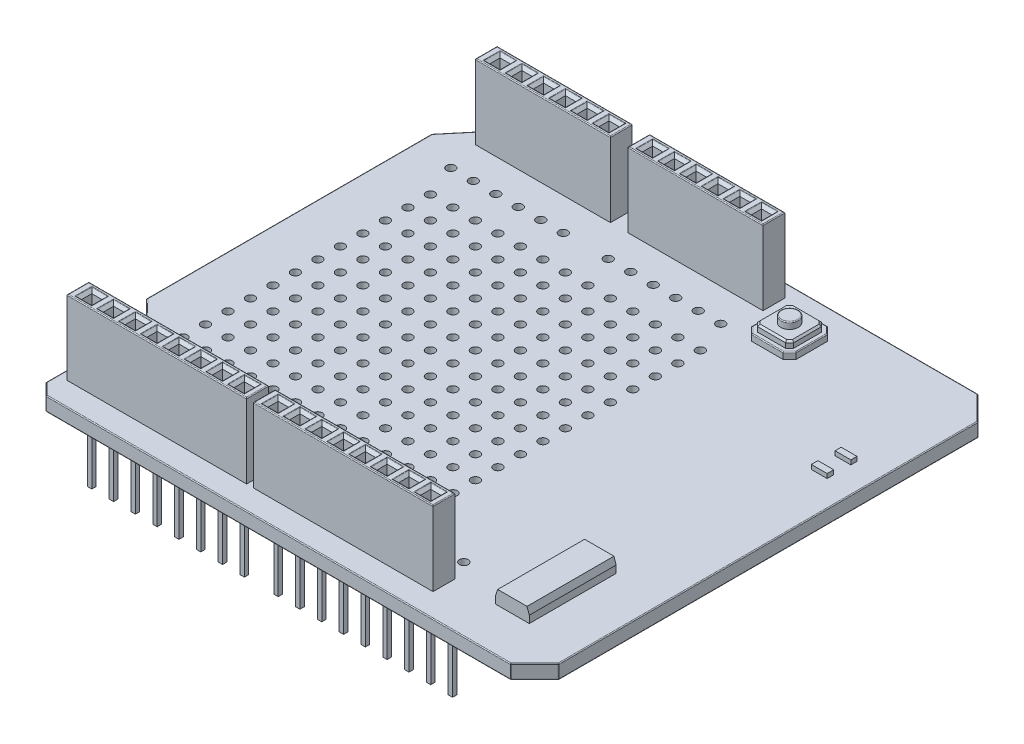
from build123d import *
from OCP.BRepFilletAPI import BRepFilletAPI_MakeChamfer

# Parameters (mm, degrees)
SKETCH1_W           = 59.91
SKETCH1_H           = 53.6
BOSS_EXTRUDE1_DEPTH = 1.63
SKETCH2_W           = 15.5
SKETCH2_H           = 2.5
SKETCH2_W_2         = 20.6
BOSS_EXTRUDE2_DEPTH = 8.54
BOSS_EXTRUDE3_DEPTH = 0.75
BOSS_EXTRUDE4_DEPTH = 0.75
SKETCH5_R           = 1
BOSS_EXTRUDE5_DEPTH = 0.75
CHAMFER1_SIZE       = 0.2
FILLET1_R           = 0.1
FILLET2_R           = 0.1
SKETCH6_W           = 3.88
SKETCH6_H           = 9.97
BOSS_EXTRUDE6_DEPTH = 1.58
CHAMFER2_SIZE       = 0.75
CHAMFER2_SIZE2      = 0.25824571
SKETCH7_W           = 1.18
SKETCH7_H           = 1.18
CUT_EXTRUDE1_DEPTH  = 6.58
CHAMFER3_SIZE       = 0.35
CHAMFER4_SIZE       = 2.75
CUT_EXTRUDE2_DEPTH  = 42.09104069
CHAMFER5_SIZE       = 1.32
SKETCH9_R           = 0.5
CUT_EXTRUDE3_DEPTH  = 42.09104069
SKETCH10_W          = 1.812646184
SKETCH10_H          = 0.701669491
SKETCH10_H_2        = 0.755269243
BOSS_EXTRUDE7_DEPTH = 0.5
SKETCH11_W          = 0.5
SKETCH11_H          = 0.5
BOSS_EXTRUDE8_DEPTH = 8.75
FILLET5_R           = 0.1
FILLET6_R           = 0.1


with BuildPart() as part:
    # Sketch1 → Boss-Extrude1 (new body)
    with BuildSketch(Plane(origin=(0, 0, 0), x_dir=(1, 0, 0), z_dir=(0, 1, 0))):
        Rectangle(SKETCH1_W, SKETCH1_H)
    extrude(amount=BOSS_EXTRUDE1_DEPTH)

    # Sketch2 → Boss-Extrude2 (add)
    with BuildSketch(Plane(origin=(0, 1.63, 0), x_dir=(1, 0, 0), z_dir=(0, 1, 0))):
        with Locations((-18.635, 23.98)):
            Rectangle(SKETCH2_W, SKETCH2_H)
        with Locations((-1.135, 23.98)):
            Rectangle(SKETCH2_W, SKETCH2_H)
        with Locations((5.295, -22.848402701)):
            Rectangle(SKETCH2_W_2, SKETCH2_H)
        with Locations((-16.085, -22.848402701)):
            Rectangle(SKETCH2_W_2, SKETCH2_H)
    extrude(amount=BOSS_EXTRUDE2_DEPTH)

    # Sketch3 → Boss-Extrude3 (add)
    with BuildSketch(Plane(origin=(0, 1.63, 0), x_dir=(1, 0, 0), z_dir=(0, 1, 0))):
        Polygon((8.995, 24.15), (12.605, 24.15), (13.355, 23.4), (13.355, 19.79), (12.605, 19.04), (8.995, 19.04), (8.245, 19.79), (8.245, 23.4), align=None)
    extrude(amount=BOSS_EXTRUDE3_DEPTH)

    # Sketch4 → Boss-Extrude4 (add)
    with BuildSketch(Plane(origin=(0, 2.38, 0), x_dir=(1, 0, 0), z_dir=(0, 1, 0))):
        Polygon((8.745, 19.997106781), (9.202106781, 19.54), (12.397893219, 19.54), (12.855, 19.997106781), (12.855, 23.192893219), (12.397893219, 23.65), (9.202106781, 23.65), (8.745, 23.192893219), align=None)
    extrude(amount=BOSS_EXTRUDE4_DEPTH)

    # Sketch5 → Boss-Extrude5 (add)
    with BuildSketch(Plane(origin=(0, 3.13, 0), x_dir=(1, 0, 0), z_dir=(0, 1, 0))):
        with Locations((10.8, 21.595)):
            Circle(SKETCH5_R)
    extrude(amount=BOSS_EXTRUDE5_DEPTH)

    # Chamfer1
    chamfer1_edges = [part.edges().sort_by_distance(p)[0] for p in [
        (8.973553391, 3.13, -23.421446609),
        (10.8, 3.13, -23.65),
        (12.626446609, 3.13, -23.421446609),
        (8.745, 3.13, -21.595),
        (8.973553391, 3.13, -19.768553391),
        (10.8, 3.13, -19.54),
        (12.626446609, 3.13, -19.768553391),
        (12.855, 3.13, -21.595),
    ]]
    chamfer(chamfer1_edges, length=CHAMFER1_SIZE)

    # Fillet1
    fillet1_edges = [part.edges().sort_by_distance(p)[0] for p in [
        (9.8, 3.88, -21.595),
    ]]
    fillet(fillet1_edges, radius=FILLET1_R)

    # Fillet2
    fillet2_edges = [part.edges().sort_by_distance(p)[0] for p in [
        (8.62, 2.38, -19.415),
        (8.245, 2.38, -21.595),
        (8.62, 2.38, -23.775),
        (10.8, 2.38, -24.15),
        (12.98, 2.38, -23.775),
        (10.8, 2.38, -19.04),
        (12.98, 2.38, -19.415),
        (13.355, 2.38, -21.595),
    ]]
    fillet(fillet2_edges, radius=FILLET2_R)

    # Sketch6 → Boss-Extrude6 (add)
    with BuildSketch(Plane(origin=(0, 1.63, 0), x_dir=(1, 0, 0), z_dir=(0, 1, 0))):
        with Locations((22.345, -16.765)):
            Rectangle(SKETCH6_W, SKETCH6_H)
    extrude(amount=BOSS_EXTRUDE6_DEPTH)

    # Chamfer2: one chamfer whose edges measure the first distance from different faces: ONE call of the kernel's chamfer builder (chamfer() names one face for all edges)
    chamfer2_edges_1 = [part.edges().sort_by_distance(p)[0] for p in [
        (20.405, 3.21, 16.765),
    ]]
    chamfer2_side_1 = [part.faces().sort_by_distance(p)[0] for p in [
        (20.405, 2.42, 16.765),
    ]]
    chamfer2_edges_2 = [part.edges().sort_by_distance(p)[0] for p in [
        (24.285, 3.21, 16.765),
    ]]
    chamfer2_side_2 = [part.faces().sort_by_distance(p)[0] for p in [
        (24.285, 2.42, 16.765),
    ]]
    chamfer2 = BRepFilletAPI_MakeChamfer(part.part.solid().wrapped)
    for e in chamfer2_edges_1:
        chamfer2.Add(CHAMFER2_SIZE, CHAMFER2_SIZE2, e.wrapped, chamfer2_side_1[0].wrapped)  # the first distance lies on this face
    for e in chamfer2_edges_2:
        chamfer2.Add(CHAMFER2_SIZE, CHAMFER2_SIZE2, e.wrapped, chamfer2_side_2[0].wrapped)  # the first distance lies on this face
    add(Compound.cast(chamfer2.Shape()), mode=Mode.REPLACE)

    # Sketch7 → Cut-Extrude1 (cut)
    with BuildSketch(Plane(origin=(0, 10.17, 0), x_dir=(1, 0, 0), z_dir=(0, 1, 0))):
        with Locations((-24.795, 23.98)):
            Rectangle(SKETCH7_W, SKETCH7_H)
        with Locations((-22.295, 23.98)):
            Rectangle(SKETCH7_W, SKETCH7_H)
        with Locations((-19.795, 23.98)):
            Rectangle(SKETCH7_W, SKETCH7_H)
        with Locations((-17.295, 23.98)):
            Rectangle(SKETCH7_W, SKETCH7_H)
        with Locations((-14.795, 23.98)):
            Rectangle(SKETCH7_W, SKETCH7_H)
        with Locations((-12.295, 23.98)):
            Rectangle(SKETCH7_W, SKETCH7_H)
        with Locations((-24.795, -22.848402701)):
            Rectangle(SKETCH7_W, SKETCH7_H)
        with Locations((-7.295, 23.98)):
            Rectangle(SKETCH7_W, SKETCH7_H)
        with Locations((-4.795, 23.98)):
            Rectangle(SKETCH7_W, SKETCH7_H)
        with Locations((-2.295, 23.98)):
            Rectangle(SKETCH7_W, SKETCH7_H)
        with Locations((0.205, 23.98)):
            Rectangle(SKETCH7_W, SKETCH7_H)
        with Locations((2.705, 23.98)):
            Rectangle(SKETCH7_W, SKETCH7_H)
        with Locations((5.205, 23.98)):
            Rectangle(SKETCH7_W, SKETCH7_H)
        with Locations((-22.295, -22.848402701)):
            Rectangle(SKETCH7_W, SKETCH7_H)
        with Locations((-19.795, -22.848402701)):
            Rectangle(SKETCH7_W, SKETCH7_H)
        with Locations((-17.295, -22.848402701)):
            Rectangle(SKETCH7_W, SKETCH7_H)
        with Locations((-14.795, -22.848402701)):
            Rectangle(SKETCH7_W, SKETCH7_H)
        with Locations((-12.295, -22.848402701)):
            Rectangle(SKETCH7_W, SKETCH7_H)
        with Locations((-9.795, -22.848402701)):
            Rectangle(SKETCH7_W, SKETCH7_H)
        with Locations((-7.295, -22.848402701)):
            Rectangle(SKETCH7_W, SKETCH7_H)
        with Locations((-3.415, -22.848402701)):
            Rectangle(SKETCH7_W, SKETCH7_H)
        with Locations((-0.915, -22.848402701)):
            Rectangle(SKETCH7_W, SKETCH7_H)
        with Locations((1.585, -22.848402701)):
            Rectangle(SKETCH7_W, SKETCH7_H)
        with Locations((4.085, -22.848402701)):
            Rectangle(SKETCH7_W, SKETCH7_H)
        with Locations((6.585, -22.848402701)):
            Rectangle(SKETCH7_W, SKETCH7_H)
        with Locations((9.085, -22.848402701)):
            Rectangle(SKETCH7_W, SKETCH7_H)
        with Locations((11.585, -22.848402701)):
            Rectangle(SKETCH7_W, SKETCH7_H)
        with Locations((14.085, -22.848402701)):
            Rectangle(SKETCH7_W, SKETCH7_H)
    extrude(amount=-CUT_EXTRUDE1_DEPTH, mode=Mode.SUBTRACT)

    # Chamfer3
    chamfer3_edges = [part.edges().sort_by_distance(p)[0] for p in [
        (-24.795, 10.17, -23.39),
        (-24.205, 10.17, -23.98),
        (-25.385, 10.17, -23.98),
        (-24.795, 10.17, -24.57),
        (14.085, 10.17, 23.438402701),
        (14.675, 10.17, 22.848402701),
        (13.495, 10.17, 22.848402701),
        (14.085, 10.17, 22.258402701),
        (11.585, 10.17, 23.438402701),
        (12.175, 10.17, 22.848402701),
        (10.995, 10.17, 22.848402701),
        (11.585, 10.17, 22.258402701),
        (9.085, 10.17, 23.438402701),
        (9.675, 10.17, 22.848402701),
        (8.495, 10.17, 22.848402701),
        (9.085, 10.17, 22.258402701),
        (6.585, 10.17, 23.438402701),
        (7.175, 10.17, 22.848402701),
        (5.995, 10.17, 22.848402701),
        (6.585, 10.17, 22.258402701),
        (4.085, 10.17, 23.438402701),
        (4.675, 10.17, 22.848402701),
        (3.495, 10.17, 22.848402701),
        (4.085, 10.17, 22.258402701),
        (1.585, 10.17, 23.438402701),
        (2.175, 10.17, 22.848402701),
        (0.995, 10.17, 22.848402701),
        (1.585, 10.17, 22.258402701),
        (-0.915, 10.17, 23.438402701),
        (-0.325, 10.17, 22.848402701),
        (-1.505, 10.17, 22.848402701),
        (-0.915, 10.17, 22.258402701),
        (-3.415, 10.17, 23.438402701),
        (-2.825, 10.17, 22.848402701),
        (-4.005, 10.17, 22.848402701),
        (-3.415, 10.17, 22.258402701),
        (-7.295, 10.17, 23.438402701),
        (-7.885, 10.17, 22.848402701),
        (-6.705, 10.17, 22.848402701),
        (-7.295, 10.17, 22.258402701),
        (-9.795, 10.17, 23.438402701),
        (-10.385, 10.17, 22.848402701),
        (-9.205, 10.17, 22.848402701),
        (-9.795, 10.17, 22.258402701),
        (-12.295, 10.17, 23.438402701),
        (-12.885, 10.17, 22.848402701),
        (-11.705, 10.17, 22.848402701),
        (-12.295, 10.17, 22.258402701),
        (-14.795, 10.17, 23.438402701),
        (-15.385, 10.17, 22.848402701),
        (-14.205, 10.17, 22.848402701),
        (-14.795, 10.17, 22.258402701),
        (-17.295, 10.17, 23.438402701),
        (-17.885, 10.17, 22.848402701),
        (-16.705, 10.17, 22.848402701),
        (-17.295, 10.17, 22.258402701),
        (-19.795, 10.17, 23.438402701),
        (-20.385, 10.17, 22.848402701),
        (-19.205, 10.17, 22.848402701),
        (-19.795, 10.17, 22.258402701),
        (-22.295, 10.17, 23.438402701),
        (-22.885, 10.17, 22.848402701),
        (-21.705, 10.17, 22.848402701),
        (-22.295, 10.17, 22.258402701),
        (-24.795, 10.17, 23.438402701),
        (-25.385, 10.17, 22.848402701),
        (-24.205, 10.17, 22.848402701),
        (-24.795, 10.17, 22.258402701),
        (5.205, 10.17, -24.57),
        (4.615, 10.17, -23.98),
        (5.795, 10.17, -23.98),
        (5.205, 10.17, -23.39),
        (2.705, 10.17, -24.57),
        (2.115, 10.17, -23.98),
        (3.295, 10.17, -23.98),
        (2.705, 10.17, -23.39),
        (0.205, 10.17, -24.57),
        (-0.385, 10.17, -23.98),
        (0.795, 10.17, -23.98),
        (0.205, 10.17, -23.39),
        (-2.295, 10.17, -24.57),
        (-2.885, 10.17, -23.98),
        (-1.705, 10.17, -23.98),
        (-2.295, 10.17, -23.39),
        (-4.795, 10.17, -24.57),
        (-5.385, 10.17, -23.98),
        (-4.205, 10.17, -23.98),
        (-4.795, 10.17, -23.39),
        (-7.295, 10.17, -24.57),
        (-7.885, 10.17, -23.98),
        (-6.705, 10.17, -23.98),
        (-7.295, 10.17, -23.39),
        (-12.295, 10.17, -23.39),
        (-12.885, 10.17, -23.98),
        (-12.295, 10.17, -24.57),
        (-11.705, 10.17, -23.98),
        (-15.385, 10.17, -23.98),
        (-14.795, 10.17, -24.57),
        (-14.205, 10.17, -23.98),
        (-14.795, 10.17, -23.39),
        (-17.885, 10.17, -23.98),
        (-17.295, 10.17, -24.57),
        (-16.705, 10.17, -23.98),
        (-17.295, 10.17, -23.39),
        (-20.385, 10.17, -23.98),
        (-19.795, 10.17, -24.57),
        (-19.205, 10.17, -23.98),
        (-19.795, 10.17, -23.39),
        (-22.295, 10.17, -23.39),
        (-21.705, 10.17, -23.98),
        (-22.885, 10.17, -23.98),
        (-22.295, 10.17, -24.57),
    ]]
    chamfer(chamfer3_edges, length=CHAMFER3_SIZE)

    # Chamfer4
    chamfer4_edges = [part.edges().sort_by_distance(p)[0] for p in [
        (29.955, 0.815, 26.8),
        (29.955, 0.815, -26.8),
    ]]
    chamfer(chamfer4_edges, length=CHAMFER4_SIZE)

    # Sketch8 → Cut-Extrude2 (cut, through all)
    with BuildSketch(Plane(origin=(0, 1.63, 0), x_dir=(1, 0, 0), z_dir=(0, 1, 0))):
        Polygon((-27.415, 26.8), (-27.415, 24.34), (-29.955, 21.3), (-29.955, 26.8), align=None)
        Polygon((-27.415, -14), (-27.415, -26.8), (-29.955, -26.8), (-29.955, -11.4), align=None)
    extrude(amount=-CUT_EXTRUDE2_DEPTH, mode=Mode.SUBTRACT)

    # Chamfer5
    chamfer5_edges = [part.edges().sort_by_distance(p)[0] for p in [
        (-27.415, 0.815, 26.8),
    ]]
    chamfer(chamfer5_edges, length=CHAMFER5_SIZE)

    # Sketch9 → Cut-Extrude3 (cut, through all)
    with BuildSketch(Plane(origin=(0, 1.63, 0), x_dir=(1, 0, 0), z_dir=(0, 1, 0))):
        with Locations((6.955, 15.2)):
            Circle(SKETCH9_R)
        with Locations((4.375, 15.2)):
            Circle(SKETCH9_R)
        with Locations((1.795, 15.2)):
            Circle(SKETCH9_R)
        with Locations((-0.785, 15.2)):
            Circle(SKETCH9_R)
        with Locations((-3.365, 15.2)):
            Circle(SKETCH9_R)
        with Locations((-5.945, 15.2)):
            Circle(SKETCH9_R)
        with Locations((-8.525, 15.2)):
            Circle(SKETCH9_R)
        with Locations((-11.105, 15.2)):
            Circle(SKETCH9_R)
        with Locations((-13.685, 15.2)):
            Circle(SKETCH9_R)
        with Locations((-16.265, 15.2)):
            Circle(SKETCH9_R)
        with Locations((-18.845, 15.2)):
            Circle(SKETCH9_R)
        with Locations((-21.425, 15.2)):
            Circle(SKETCH9_R)
        with Locations((-24.005, 15.2)):
            Circle(SKETCH9_R)
        with Locations((6.955, 12.62)):
            Circle(SKETCH9_R)
        with Locations((4.375, 12.62)):
            Circle(SKETCH9_R)
        with Locations((1.795, 12.62)):
            Circle(SKETCH9_R)
        with Locations((-0.785, 12.62)):
            Circle(SKETCH9_R)
        with Locations((-3.365, 12.62)):
            Circle(SKETCH9_R)
        with Locations((-5.945, 12.62)):
            Circle(SKETCH9_R)
        with Locations((-8.525, 12.62)):
            Circle(SKETCH9_R)
        with Locations((-11.105, 12.62)):
            Circle(SKETCH9_R)
        with Locations((-13.685, 12.62)):
            Circle(SKETCH9_R)
        with Locations((-16.265, 12.62)):
            Circle(SKETCH9_R)
        with Locations((-18.845, 12.62)):
            Circle(SKETCH9_R)
        with Locations((-21.425, 12.62)):
            Circle(SKETCH9_R)
        with Locations((-24.005, 12.62)):
            Circle(SKETCH9_R)
        with Locations((6.955, 10.04)):
            Circle(SKETCH9_R)
        with Locations((4.375, 10.04)):
            Circle(SKETCH9_R)
        with Locations((1.795, 10.04)):
            Circle(SKETCH9_R)
        with Locations((-0.785, 10.04)):
            Circle(SKETCH9_R)
        with Locations((-3.365, 10.04)):
            Circle(SKETCH9_R)
        with Locations((-5.945, 10.04)):
            Circle(SKETCH9_R)
        with Locations((-8.525, 10.04)):
            Circle(SKETCH9_R)
        with Locations((-11.105, 10.04)):
            Circle(SKETCH9_R)
        with Locations((-13.685, 10.04)):
            Circle(SKETCH9_R)
        with Locations((-16.265, 10.04)):
            Circle(SKETCH9_R)
        with Locations((-18.845, 10.04)):
            Circle(SKETCH9_R)
        with Locations((-21.425, 10.04)):
            Circle(SKETCH9_R)
        with Locations((-24.005, 10.04)):
            Circle(SKETCH9_R)
        with Locations((6.955, 7.46)):
            Circle(SKETCH9_R)
        with Locations((4.375, 7.46)):
            Circle(SKETCH9_R)
        with Locations((1.795, 7.46)):
            Circle(SKETCH9_R)
        with Locations((-0.785, 7.46)):
            Circle(SKETCH9_R)
        with Locations((-3.365, 7.46)):
            Circle(SKETCH9_R)
        with Locations((-5.945, 7.46)):
            Circle(SKETCH9_R)
        with Locations((-8.525, 7.46)):
            Circle(SKETCH9_R)
        with Locations((-11.105, 7.46)):
            Circle(SKETCH9_R)
        with Locations((-13.685, 7.46)):
            Circle(SKETCH9_R)
        with Locations((-16.265, 7.46)):
            Circle(SKETCH9_R)
        with Locations((-18.845, 7.46)):
            Circle(SKETCH9_R)
        with Locations((-21.425, 7.46)):
            Circle(SKETCH9_R)
        with Locations((-24.005, 7.46)):
            Circle(SKETCH9_R)
        with Locations((6.955, 4.88)):
            Circle(SKETCH9_R)
        with Locations((4.375, 4.88)):
            Circle(SKETCH9_R)
        with Locations((1.795, 4.88)):
            Circle(SKETCH9_R)
        with Locations((-0.785, 4.88)):
            Circle(SKETCH9_R)
        with Locations((-3.365, 4.88)):
            Circle(SKETCH9_R)
        with Locations((-5.945, 4.88)):
            Circle(SKETCH9_R)
        with Locations((-8.525, 4.88)):
            Circle(SKETCH9_R)
        with Locations((-11.105, 4.88)):
            Circle(SKETCH9_R)
        with Locations((-13.685, 4.88)):
            Circle(SKETCH9_R)
        with Locations((-16.265, 4.88)):
            Circle(SKETCH9_R)
        with Locations((-18.845, 4.88)):
            Circle(SKETCH9_R)
        with Locations((-21.425, 4.88)):
            Circle(SKETCH9_R)
        with Locations((-24.005, 4.88)):
            Circle(SKETCH9_R)
        with Locations((6.955, 2.3)):
            Circle(SKETCH9_R)
        with Locations((4.375, 2.3)):
            Circle(SKETCH9_R)
        with Locations((1.795, 2.3)):
            Circle(SKETCH9_R)
        with Locations((-0.785, 2.3)):
            Circle(SKETCH9_R)
        with Locations((-3.365, 2.3)):
            Circle(SKETCH9_R)
        with Locations((-5.945, 2.3)):
            Circle(SKETCH9_R)
        with Locations((-8.525, 2.3)):
            Circle(SKETCH9_R)
        with Locations((-11.105, 2.3)):
            Circle(SKETCH9_R)
        with Locations((-13.685, 2.3)):
            Circle(SKETCH9_R)
        with Locations((-16.265, 2.3)):
            Circle(SKETCH9_R)
        with Locations((-18.845, 2.3)):
            Circle(SKETCH9_R)
        with Locations((-21.425, 2.3)):
            Circle(SKETCH9_R)
        with Locations((-24.005, 2.3)):
            Circle(SKETCH9_R)
        with Locations((6.955, -0.28)):
            Circle(SKETCH9_R)
        with Locations((4.375, -0.28)):
            Circle(SKETCH9_R)
        with Locations((1.795, -0.28)):
            Circle(SKETCH9_R)
        with Locations((-0.785, -0.28)):
            Circle(SKETCH9_R)
        with Locations((-3.365, -0.28)):
            Circle(SKETCH9_R)
        with Locations((-5.945, -0.28)):
            Circle(SKETCH9_R)
        with Locations((-8.525, -0.28)):
            Circle(SKETCH9_R)
        with Locations((-11.105, -0.28)):
            Circle(SKETCH9_R)
        with Locations((-13.685, -0.28)):
            Circle(SKETCH9_R)
        with Locations((-16.265, -0.28)):
            Circle(SKETCH9_R)
        with Locations((-18.845, -0.28)):
            Circle(SKETCH9_R)
        with Locations((-21.425, -0.28)):
            Circle(SKETCH9_R)
        with Locations((-24.005, -0.28)):
            Circle(SKETCH9_R)
        with Locations((6.955, -2.86)):
            Circle(SKETCH9_R)
        with Locations((4.375, -2.86)):
            Circle(SKETCH9_R)
        with Locations((1.795, -2.86)):
            Circle(SKETCH9_R)
        with Locations((-0.785, -2.86)):
            Circle(SKETCH9_R)
        with Locations((-3.365, -2.86)):
            Circle(SKETCH9_R)
        with Locations((-5.945, -2.86)):
            Circle(SKETCH9_R)
        with Locations((-8.525, -2.86)):
            Circle(SKETCH9_R)
        with Locations((-11.105, -2.86)):
            Circle(SKETCH9_R)
        with Locations((-13.685, -2.86)):
            Circle(SKETCH9_R)
        with Locations((-16.265, -2.86)):
            Circle(SKETCH9_R)
        with Locations((-18.845, -2.86)):
            Circle(SKETCH9_R)
        with Locations((-21.425, -2.86)):
            Circle(SKETCH9_R)
        with Locations((-24.005, -2.86)):
            Circle(SKETCH9_R)
        with Locations((6.955, -5.44)):
            Circle(SKETCH9_R)
        with Locations((4.375, -5.44)):
            Circle(SKETCH9_R)
        with Locations((1.795, -5.44)):
            Circle(SKETCH9_R)
        with Locations((-0.785, -5.44)):
            Circle(SKETCH9_R)
        with Locations((-3.365, -5.44)):
            Circle(SKETCH9_R)
        with Locations((-5.945, -5.44)):
            Circle(SKETCH9_R)
        with Locations((-8.525, -5.44)):
            Circle(SKETCH9_R)
        with Locations((-11.105, -5.44)):
            Circle(SKETCH9_R)
        with Locations((-13.685, -5.44)):
            Circle(SKETCH9_R)
        with Locations((-16.265, -5.44)):
            Circle(SKETCH9_R)
        with Locations((-18.845, -5.44)):
            Circle(SKETCH9_R)
        with Locations((-21.425, -5.44)):
            Circle(SKETCH9_R)
        with Locations((-24.005, -5.44)):
            Circle(SKETCH9_R)
        with Locations((6.955, -8.02)):
            Circle(SKETCH9_R)
        with Locations((4.375, -8.02)):
            Circle(SKETCH9_R)
        with Locations((1.795, -8.02)):
            Circle(SKETCH9_R)
        with Locations((-0.785, -8.02)):
            Circle(SKETCH9_R)
        with Locations((-3.365, -8.02)):
            Circle(SKETCH9_R)
        with Locations((-5.945, -8.02)):
            Circle(SKETCH9_R)
        with Locations((-8.525, -8.02)):
            Circle(SKETCH9_R)
        with Locations((-11.105, -8.02)):
            Circle(SKETCH9_R)
        with Locations((-13.685, -8.02)):
            Circle(SKETCH9_R)
        with Locations((-16.265, -8.02)):
            Circle(SKETCH9_R)
        with Locations((-18.845, -8.02)):
            Circle(SKETCH9_R)
        with Locations((-21.425, -8.02)):
            Circle(SKETCH9_R)
        with Locations((-24.005, -8.02)):
            Circle(SKETCH9_R)
        with Locations((6.955, -10.6)):
            Circle(SKETCH9_R)
        with Locations((4.375, -10.6)):
            Circle(SKETCH9_R)
        with Locations((1.795, -10.6)):
            Circle(SKETCH9_R)
        with Locations((-0.785, -10.6)):
            Circle(SKETCH9_R)
        with Locations((-3.365, -10.6)):
            Circle(SKETCH9_R)
        with Locations((-5.945, -10.6)):
            Circle(SKETCH9_R)
        with Locations((-8.525, -10.6)):
            Circle(SKETCH9_R)
        with Locations((-11.105, -10.6)):
            Circle(SKETCH9_R)
        with Locations((-13.685, -10.6)):
            Circle(SKETCH9_R)
        with Locations((-16.265, -10.6)):
            Circle(SKETCH9_R)
        with Locations((-18.845, -10.6)):
            Circle(SKETCH9_R)
        with Locations((-21.425, -10.6)):
            Circle(SKETCH9_R)
        with Locations((-24.005, -10.6)):
            Circle(SKETCH9_R)
        with Locations((6.955, -13.18)):
            Circle(SKETCH9_R)
        with Locations((4.375, -13.18)):
            Circle(SKETCH9_R)
        with Locations((1.795, -13.18)):
            Circle(SKETCH9_R)
        with Locations((-0.785, -13.18)):
            Circle(SKETCH9_R)
        with Locations((-3.365, -13.18)):
            Circle(SKETCH9_R)
        with Locations((-5.945, -13.18)):
            Circle(SKETCH9_R)
        with Locations((-8.525, -13.18)):
            Circle(SKETCH9_R)
        with Locations((-11.105, -13.18)):
            Circle(SKETCH9_R)
        with Locations((-13.685, -13.18)):
            Circle(SKETCH9_R)
        with Locations((-16.265, -13.18)):
            Circle(SKETCH9_R)
        with Locations((-18.845, -13.18)):
            Circle(SKETCH9_R)
        with Locations((-21.425, -13.18)):
            Circle(SKETCH9_R)
        with Locations((-24.005, -13.18)):
            Circle(SKETCH9_R)
        with Locations((6.955, -15.76)):
            Circle(SKETCH9_R)
        with Locations((4.375, -15.76)):
            Circle(SKETCH9_R)
        with Locations((1.795, -15.76)):
            Circle(SKETCH9_R)
        with Locations((-0.785, -15.76)):
            Circle(SKETCH9_R)
        with Locations((-3.365, -15.76)):
            Circle(SKETCH9_R)
        with Locations((-5.945, -15.76)):
            Circle(SKETCH9_R)
        with Locations((-8.525, -15.76)):
            Circle(SKETCH9_R)
        with Locations((-11.105, -15.76)):
            Circle(SKETCH9_R)
        with Locations((-13.685, -15.76)):
            Circle(SKETCH9_R)
        with Locations((-16.265, -15.76)):
            Circle(SKETCH9_R)
        with Locations((-18.845, -15.76)):
            Circle(SKETCH9_R)
        with Locations((-21.425, -15.76)):
            Circle(SKETCH9_R)
        with Locations((-24.005, -15.76)):
            Circle(SKETCH9_R)
        with Locations((-25.469940781, 19.005930056)):
            Circle(SKETCH9_R)
        with Locations((-22.889940781, 19.005930056)):
            Circle(SKETCH9_R)
        with Locations((-20.309940781, 19.005930056)):
            Circle(SKETCH9_R)
        with Locations((-17.729940781, 19.005930056)):
            Circle(SKETCH9_R)
        with Locations((-15.149940781, 19.005930056)):
            Circle(SKETCH9_R)
        with Locations((-12.569940781, 19.005930056)):
            Circle(SKETCH9_R)
        with Locations((-7.413471247, 19.005930056)):
            Circle(SKETCH9_R)
        with Locations((-4.833471247, 19.005930056)):
            Circle(SKETCH9_R)
        with Locations((-2.253471247, 19.005930056)):
            Circle(SKETCH9_R)
        with Locations((0.326528753, 19.005930056)):
            Circle(SKETCH9_R)
        with Locations((2.906528753, 19.005930056)):
            Circle(SKETCH9_R)
        with Locations((5.486528753, 19.005930056)):
            Circle(SKETCH9_R)
        with Locations((-25.469940781, -19.403210889)):
            Circle(SKETCH9_R)
        with Locations((-22.889940781, -19.403210889)):
            Circle(SKETCH9_R)
        with Locations((-20.309940781, -19.403210889)):
            Circle(SKETCH9_R)
        with Locations((-17.729940781, -19.403210889)):
            Circle(SKETCH9_R)
        with Locations((-15.149940781, -19.403210889)):
            Circle(SKETCH9_R)
        with Locations((-12.569940781, -19.403210889)):
            Circle(SKETCH9_R)
        with Locations((-9.989940781, -19.403210889)):
            Circle(SKETCH9_R)
        with Locations((-7.409940781, -19.403210889)):
            Circle(SKETCH9_R)
        with Locations((-3.631327581, -19.403210889)):
            Circle(SKETCH9_R)
        with Locations((-1.051327581, -19.403210889)):
            Circle(SKETCH9_R)
        with Locations((1.528672419, -19.403210889)):
            Circle(SKETCH9_R)
        with Locations((4.108672419, -19.403210889)):
            Circle(SKETCH9_R)
        with Locations((6.688672419, -19.403210889)):
            Circle(SKETCH9_R)
        with Locations((9.268672419, -19.403210889)):
            Circle(SKETCH9_R)
        with Locations((11.848672419, -19.403210889)):
            Circle(SKETCH9_R)
        with Locations((14.428672419, -19.403210889)):
            Circle(SKETCH9_R)
    extrude(amount=-CUT_EXTRUDE3_DEPTH, mode=Mode.SUBTRACT)

    # Sketch10 → Boss-Extrude7 (add)
    with BuildSketch(Plane(origin=(0, 1.63, 0), x_dir=(1, 0, 0), z_dir=(0, 1, 0))):
        with Locations((26.060630769, 12.805100933)):
            Rectangle(SKETCH10_W, SKETCH10_H)
        with Locations((26.060630769, 10.112931533)):
            Rectangle(SKETCH10_W, SKETCH10_H_2)
    extrude(amount=BOSS_EXTRUDE7_DEPTH)

    # Sketch11 → Boss-Extrude8 (add)
    with BuildSketch(Plane.XZ):
        with Locations((-22.295, 22.848402701)):
            Rectangle(SKETCH11_W, SKETCH11_H)
        with Locations((-24.795, 22.848402701)):
            Rectangle(SKETCH11_W, SKETCH11_H)
        with Locations((-19.795, 22.848402701)):
            Rectangle(SKETCH11_W, SKETCH11_H)
        with Locations((-17.295, 22.848402701)):
            Rectangle(SKETCH11_W, SKETCH11_H)
        with Locations((-14.795, 22.848402701)):
            Rectangle(SKETCH11_W, SKETCH11_H)
        with Locations((-12.295, 22.848402701)):
            Rectangle(SKETCH11_W, SKETCH11_H)
        with Locations((-9.795, 22.848402701)):
            Rectangle(SKETCH11_W, SKETCH11_H)
        with Locations((-7.295, 22.848402701)):
            Rectangle(SKETCH11_W, SKETCH11_H)
        with Locations((-0.915, 22.848402701)):
            Rectangle(SKETCH11_W, SKETCH11_H)
        with Locations((-3.415, 22.848402701)):
            Rectangle(SKETCH11_W, SKETCH11_H)
        with Locations((1.585, 22.848402701)):
            Rectangle(SKETCH11_W, SKETCH11_H)
        with Locations((4.085, 22.848402701)):
            Rectangle(SKETCH11_W, SKETCH11_H)
        with Locations((6.585, 22.848402701)):
            Rectangle(SKETCH11_W, SKETCH11_H)
        with Locations((9.085, 22.848402701)):
            Rectangle(SKETCH11_W, SKETCH11_H)
        with Locations((11.585, 22.848402701)):
            Rectangle(SKETCH11_W, SKETCH11_H)
        with Locations((14.085, 22.848402701)):
            Rectangle(SKETCH11_W, SKETCH11_H)
        with Locations((16.585, 22.848402701)):
            Rectangle(SKETCH11_W, SKETCH11_H)
        with Locations((-22.295, -23.98)):
            Rectangle(SKETCH11_W, SKETCH11_H)
        with Locations((-24.795, -23.98)):
            Rectangle(SKETCH11_W, SKETCH11_H)
        with Locations((-19.795, -23.98)):
            Rectangle(SKETCH11_W, SKETCH11_H)
        with Locations((-17.295, -23.98)):
            Rectangle(SKETCH11_W, SKETCH11_H)
        with Locations((-14.795, -23.98)):
            Rectangle(SKETCH11_W, SKETCH11_H)
        with Locations((-12.295, -23.98)):
            Rectangle(SKETCH11_W, SKETCH11_H)
        with Locations((-7.295, -23.98)):
            Rectangle(SKETCH11_W, SKETCH11_H)
        with Locations((-4.795, -23.98)):
            Rectangle(SKETCH11_W, SKETCH11_H)
        with Locations((-2.295, -23.98)):
            Rectangle(SKETCH11_W, SKETCH11_H)
        with Locations((0.205, -23.98)):
            Rectangle(SKETCH11_W, SKETCH11_H)
        with Locations((2.705, -23.98)):
            Rectangle(SKETCH11_W, SKETCH11_H)
        with Locations((5.205, -23.98)):
            Rectangle(SKETCH11_W, SKETCH11_H)
    extrude(amount=BOSS_EXTRUDE8_DEPTH)

    # Fillet5
    fillet5_edges = [part.edges().sort_by_distance(p)[0] for p in [
        (-8.885, 10.17, -23.98),
        (-1.135, 10.17, -25.23),
        (6.615, 10.17, -23.98),
        (-1.135, 10.17, -22.73),
        (-7.295, 10.17, -23.04),
        (-6.355, 10.17, -23.98),
        (-7.295, 10.17, -24.92),
        (-8.235, 10.17, -23.98),
        (-4.795, 10.17, -23.04),
        (-3.855, 10.17, -23.98),
        (-4.795, 10.17, -24.92),
        (-5.735, 10.17, -23.98),
        (-2.295, 10.17, -23.04),
        (-1.355, 10.17, -23.98),
        (-2.295, 10.17, -24.92),
        (-3.235, 10.17, -23.98),
        (0.205, 10.17, -23.04),
        (1.145, 10.17, -23.98),
        (0.205, 10.17, -24.92),
        (-0.735, 10.17, -23.98),
        (2.705, 10.17, -23.04),
        (3.645, 10.17, -23.98),
        (2.705, 10.17, -24.92),
        (1.765, 10.17, -23.98),
        (5.205, 10.17, -23.04),
        (6.145, 10.17, -23.98),
        (5.205, 10.17, -24.92),
        (4.265, 10.17, -23.98),
        (-18.635, 10.17, -22.73),
        (-26.385, 10.17, -23.98),
        (-18.635, 10.17, -25.23),
        (-10.885, 10.17, -23.98),
        (-24.795, 10.17, -24.92),
        (-25.735, 10.17, -23.98),
        (-24.795, 10.17, -23.04),
        (-23.855, 10.17, -23.98),
        (-22.295, 10.17, -24.92),
        (-23.235, 10.17, -23.98),
        (-22.295, 10.17, -23.04),
        (-21.355, 10.17, -23.98),
        (-18.855, 10.17, -23.98),
        (-19.795, 10.17, -24.92),
        (-20.735, 10.17, -23.98),
        (-19.795, 10.17, -23.04),
        (-16.355, 10.17, -23.98),
        (-17.295, 10.17, -24.92),
        (-18.235, 10.17, -23.98),
        (-17.295, 10.17, -23.04),
        (-13.855, 10.17, -23.98),
        (-14.795, 10.17, -24.92),
        (-15.735, 10.17, -23.98),
        (-14.795, 10.17, -23.04),
        (-12.295, 10.17, -24.92),
        (-13.235, 10.17, -23.98),
        (-12.295, 10.17, -23.04),
        (-11.355, 10.17, -23.98),
        (-3.415, 10.17, 21.908402701),
        (-4.355, 10.17, 22.848402701),
        (-3.415, 10.17, 23.788402701),
        (-2.475, 10.17, 22.848402701),
        (-0.915, 10.17, 21.908402701),
        (-1.855, 10.17, 22.848402701),
        (-0.915, 10.17, 23.788402701),
        (0.025, 10.17, 22.848402701),
        (1.585, 10.17, 21.908402701),
        (0.645, 10.17, 22.848402701),
        (1.585, 10.17, 23.788402701),
        (2.525, 10.17, 22.848402701),
        (4.085, 10.17, 21.908402701),
        (3.145, 10.17, 22.848402701),
        (4.085, 10.17, 23.788402701),
        (5.025, 10.17, 22.848402701),
        (6.585, 10.17, 21.908402701),
        (5.645, 10.17, 22.848402701),
        (6.585, 10.17, 23.788402701),
        (7.525, 10.17, 22.848402701),
        (9.085, 10.17, 21.908402701),
        (8.145, 10.17, 22.848402701),
        (9.085, 10.17, 23.788402701),
        (10.025, 10.17, 22.848402701),
        (11.585, 10.17, 21.908402701),
        (10.645, 10.17, 22.848402701),
        (11.585, 10.17, 23.788402701),
        (12.525, 10.17, 22.848402701),
        (14.085, 10.17, 21.908402701),
        (13.145, 10.17, 22.848402701),
        (14.085, 10.17, 23.788402701),
        (15.025, 10.17, 22.848402701),
        (-16.085, 10.17, 24.098402701),
        (-26.385, 10.17, 22.848402701),
        (-16.085, 10.17, 21.598402701),
        (-5.785, 10.17, 22.848402701),
        (-24.795, 10.17, 21.908402701),
        (-25.735, 10.17, 22.848402701),
        (-24.795, 10.17, 23.788402701),
        (-23.855, 10.17, 22.848402701),
        (-22.295, 10.17, 21.908402701),
        (-23.235, 10.17, 22.848402701),
        (-22.295, 10.17, 23.788402701),
        (-21.355, 10.17, 22.848402701),
        (-19.795, 10.17, 21.908402701),
        (-20.735, 10.17, 22.848402701),
        (-19.795, 10.17, 23.788402701),
        (-18.855, 10.17, 22.848402701),
        (-17.295, 10.17, 21.908402701),
        (-18.235, 10.17, 22.848402701),
        (-17.295, 10.17, 23.788402701),
        (-16.355, 10.17, 22.848402701),
        (-14.795, 10.17, 21.908402701),
        (-15.735, 10.17, 22.848402701),
        (-14.795, 10.17, 23.788402701),
        (-13.855, 10.17, 22.848402701),
        (-12.295, 10.17, 21.908402701),
        (-13.235, 10.17, 22.848402701),
        (-12.295, 10.17, 23.788402701),
        (-11.355, 10.17, 22.848402701),
        (-9.795, 10.17, 21.908402701),
        (-10.735, 10.17, 22.848402701),
        (-9.795, 10.17, 23.788402701),
        (-8.855, 10.17, 22.848402701),
        (-7.295, 10.17, 21.908402701),
        (-8.235, 10.17, 22.848402701),
        (-7.295, 10.17, 23.788402701),
        (-6.355, 10.17, 22.848402701),
        (-5.005, 10.17, 22.848402701),
        (5.295, 10.17, 21.598402701),
        (15.595, 10.17, 22.848402701),
        (5.295, 10.17, 24.098402701),
    ]]
    fillet(fillet5_edges, radius=FILLET5_R)

    # Fillet6
    fillet6_edges = [part.edges().sort_by_distance(p)[0] for p in [
        (28.58, 0, -25.425),
        (28.58, 1.63, -25.425),
        (27.205, 0.815, -26.8),
        (-0.105, 1.63, -26.8),
        (-0.105, 0, -26.8),
        (-27.415, 0, -25.57),
        (-27.415, 0.815, -26.8),
        (-27.415, 1.63, -25.57),
        (-28.685, 0, -22.82),
        (-27.415, 0.815, -24.34),
        (-28.685, 1.63, -22.82),
        (-29.955, 0.815, -21.3),
        (-29.955, 1.63, -4.95),
        (-29.955, 0, -4.95),
        (-28.685, 0, 12.7),
        (-29.955, 0.815, 11.4),
        (-28.685, 1.63, 12.7),
        (-27.415, 0.815, 14),
        (-27.415, 1.63, 19.74),
        (-27.415, 0, 19.74),
        (-27.415, 0.815, 25.48),
        (-26.755, 1.63, 26.14),
        (-26.755, 0, 26.14),
        (0.555, 0, 26.8),
        (-26.095, 0.815, 26.8),
        (0.555, 1.63, 26.8),
        (28.58, 0, 25.425),
        (27.205, 0.815, 26.8),
        (28.58, 1.63, 25.425),
        (29.955, 0.815, -24.05),
        (29.955, 0, 0),
        (29.955, 0.815, 24.05),
        (29.955, 1.63, 0),
    ]]
    fillet(fillet6_edges, radius=FILLET6_R)


solid = part.part
